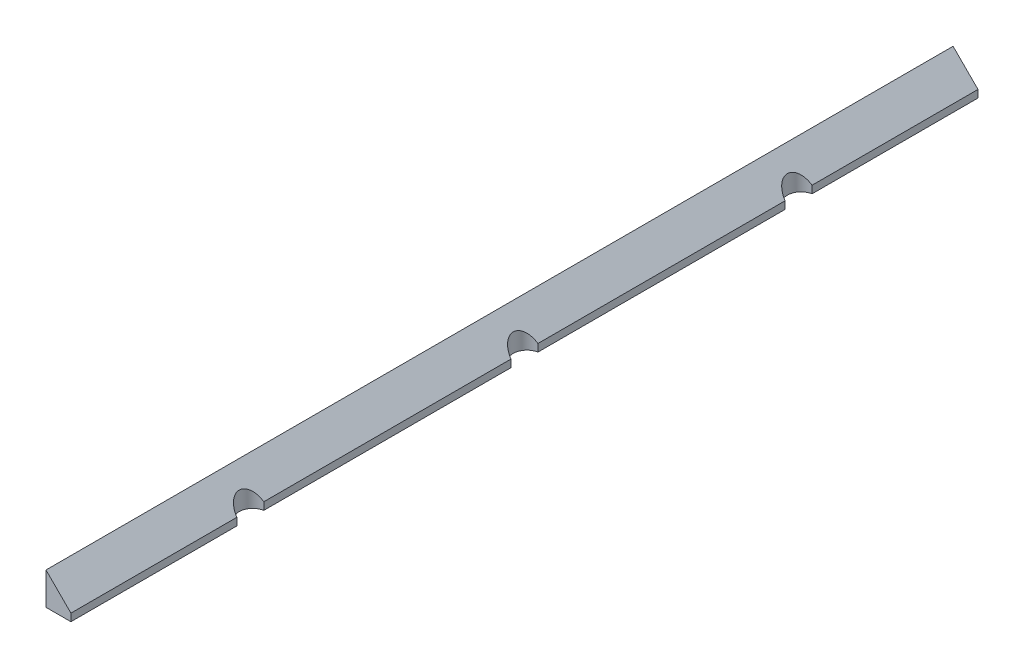
from build123d import *

# Parameters (mm, degrees)
BOSS_EXTRUDE1_DEPTH = 36.4
CUT_EXTRUDE1_REACH  = 38.548
SKETCH2_R           = 1.1


with BuildPart() as part:
    # Sketch1 → Boss-Extrude1 (new, symmetric)
    with BuildSketch(Plane.XY):
        Polygon((0, 2.6), (0, 0), (2, 0), (2, 0.6), align=None)
    extrude(amount=BOSS_EXTRUDE1_DEPTH, both=True)

    # Cut-Extrude1: up to this face of the body (flat: up to its plane)
    cut_extrude1_end = Plane(part.part.faces().sort_by_distance((1, 1.6, 0))[0])
    # Sketch2 → Cut-Extrude1 (cut, up to the picked face)
    with BuildSketch(Plane.XZ, mode=Mode.PRIVATE) as cut_extrude1_sk1:
        with Locations((2.2, 0)):
            Circle(SKETCH2_R)
    cut_extrude1_tool1 = split(extrude(cut_extrude1_sk1.sketch, amount=-CUT_EXTRUDE1_REACH, mode=Mode.PRIVATE), bisect_by=cut_extrude1_end, keep=Keep.BOTH, mode=Mode.PRIVATE)
    # Sketch2 → Cut-Extrude1 (cut, up to the picked face)
    with BuildSketch(Plane.XZ, mode=Mode.PRIVATE) as cut_extrude1_sk2:
        with Locations((2.2, 22)):
            Circle(SKETCH2_R)
    cut_extrude1_tool2 = split(extrude(cut_extrude1_sk2.sketch, amount=-CUT_EXTRUDE1_REACH, mode=Mode.PRIVATE), bisect_by=cut_extrude1_end, keep=Keep.BOTH, mode=Mode.PRIVATE)
    # Sketch2 → Cut-Extrude1 (cut, up to the picked face)
    with BuildSketch(Plane.XZ, mode=Mode.PRIVATE) as cut_extrude1_sk3:
        with Locations((2.2, -22)):
            Circle(SKETCH2_R)
    cut_extrude1_tool3 = split(extrude(cut_extrude1_sk3.sketch, amount=-CUT_EXTRUDE1_REACH, mode=Mode.PRIVATE), bisect_by=cut_extrude1_end, keep=Keep.BOTH, mode=Mode.PRIVATE)
    add(cut_extrude1_tool1.solids().sort_by(Axis((2.2, 0, 0), (0, 1, 0)))[0], mode=Mode.SUBTRACT)
    add(cut_extrude1_tool2.solids().sort_by(Axis((2.2, 0, 22), (0, 1, 0)))[0], mode=Mode.SUBTRACT)
    add(cut_extrude1_tool3.solids().sort_by(Axis((2.2, 0, -22), (0, 1, 0)))[0], mode=Mode.SUBTRACT)


solid = part.part
